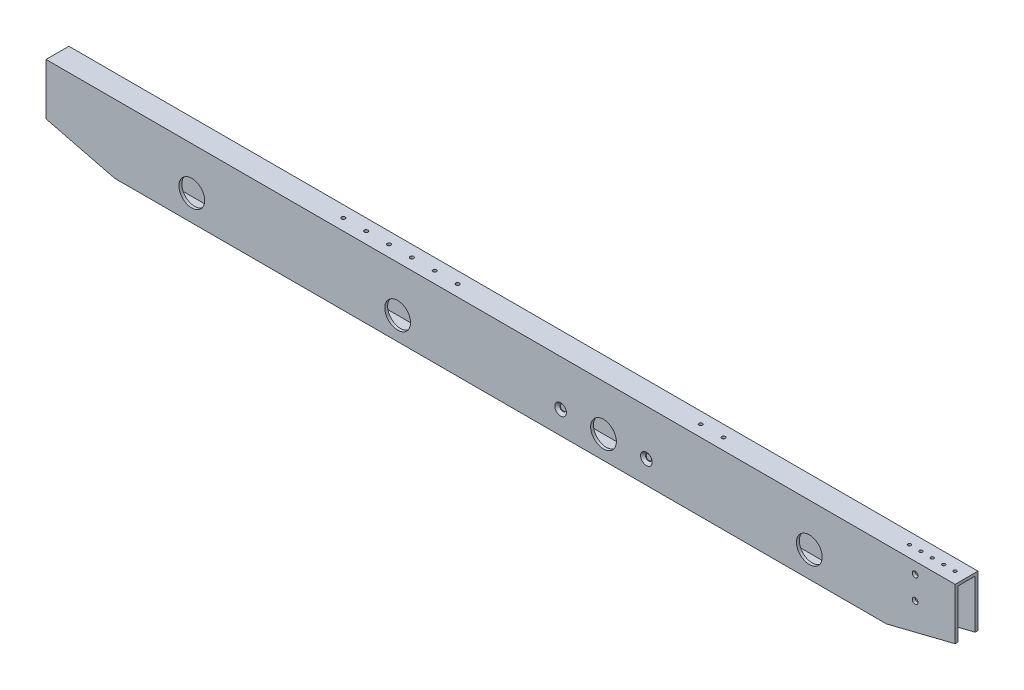
from build123d import *

# Parameters (mm, degrees)
SKETCH1_W                                           = 1009.65
SKETCH1_H                                           = 76.2
SKETCH1_R                                           = 14.2875
BOSS_EXTRUDE2_DEPTH                                 = 12.7
SKETCH3_W                                           = 19.05
SKETCH3_H                                           = 69.85
CUT_EXTRUDE2_DEPTH                                  = 1011.448426442
CUT_EXTRUDE3_DEPTH                                  = 507.897475457
SKETCH9_R                                           = 1.7272
CUT_EXTRUDE4_DEPTH                                  = 2.54
SKETCH12_R                                          = 2.0193
CUT_EXTRUDE7_DEPTH                                  = 5.08
CSK_FOR_1_4_FLAT_HEAD_MACHINE_SCREW_100_D           = 6.7564
CSK_FOR_1_4_FLAT_HEAD_MACHINE_SCREW_100_CSINK_D     = 12.8778
CSK_FOR_1_4_FLAT_HEAD_MACHINE_SCREW_100_CSINK_ANGLE = 100
SKETCH17_R                                          = 1.7272
CUT_EXTRUDE8_DEPTH                                  = 6.35
SKETCH18_R                                          = 17.4625
CUT_EXTRUDE9_DEPTH                                  = 3.81
F_1_4_0_25_DIAMETER_HOLE1_D                         = 6.35
F_10_32_TAPPED_HOLE2_D                              = 4.0386


with BuildPart() as part:
    # Sketch1 → Boss-Extrude2 (new, symmetric)
    with BuildSketch(Plane.XY):
        Rectangle(SKETCH1_W, SKETCH1_H)
        with Locations((-114.3, -12.7)):
            Circle(SKETCH1_R, mode=Mode.SUBTRACT)
        with Locations((114.3, -12.7)):
            Circle(SKETCH1_R, mode=Mode.SUBTRACT)
        with Locations((-342.9, -9.525)):
            Circle(SKETCH1_R, mode=Mode.SUBTRACT)
        with Locations((342.9, -9.525)):
            Circle(SKETCH1_R, mode=Mode.SUBTRACT)
    extrude(amount=BOSS_EXTRUDE2_DEPTH, both=True)

    # Sketch3 → Cut-Extrude2 (cut, through all)
    with BuildSketch(Plane(origin=(504.825, 0, 0), x_dir=(0, 0, -1), z_dir=(1, 0, 0))):
        Rectangle(SKETCH3_W, SKETCH3_H)
    extrude(amount=-CUT_EXTRUDE2_DEPTH, mode=Mode.SUBTRACT)

    # Sketch4 → Cut-Extrude3 (cut, through all)
    with BuildSketch(Plane.XY.offset(12.7)):
        Polygon((-504.825, -38.1), (-504.825, -19.05), (-428.625, -38.1), align=None)
        Polygon((428.625, -38.1), (504.825, -38.1), (504.825, -19.05), align=None)
    extrude(amount=-CUT_EXTRUDE3_DEPTH, mode=Mode.SUBTRACT)

    # Sketch9 → Cut-Extrude4 (cut)
    with BuildSketch(Plane(origin=(0, 38.1, 0), x_dir=(1, 0, 0), z_dir=(0, 1, 0))):
        with Locations((492.125, 0)):
            Circle(SKETCH9_R)
        with Locations((479.425, 0)):
            Circle(SKETCH9_R)
        with Locations((466.725, 0)):
            Circle(SKETCH9_R)
        with Locations((454.025, 0)):
            Circle(SKETCH9_R)
        with Locations((441.325, 0)):
            Circle(SKETCH9_R)
    extrude(amount=-CUT_EXTRUDE4_DEPTH, mode=Mode.SUBTRACT)

    # Sketch12 → Cut-Extrude7 (cut)
    with BuildSketch(Plane(origin=(0, 38.1, 0), x_dir=(1, 0, 0), z_dir=(0, 1, 0))):
        with Locations((-187.325, 0)):
            Circle(SKETCH12_R)
        with Locations((-161.925, 0)):
            Circle(SKETCH12_R)
        with Locations((-136.525, 0)):
            Circle(SKETCH12_R)
        with Locations((-111.125, 0)):
            Circle(SKETCH12_R)
        with Locations((-85.725, 0)):
            Circle(SKETCH12_R)
        with Locations((-60.325, 0)):
            Circle(SKETCH12_R)
    extrude(amount=-CUT_EXTRUDE7_DEPTH, mode=Mode.SUBTRACT)

    # CSK for 1/4 Flat Head Machine Screw (100)2 (through all)
    with Locations(Plane.XY.offset(12.7)):
        with Locations((66.675, -12.7), (161.925, -12.7)):
            CounterSinkHole(CSK_FOR_1_4_FLAT_HEAD_MACHINE_SCREW_100_D / 2, CSK_FOR_1_4_FLAT_HEAD_MACHINE_SCREW_100_CSINK_D / 2, counter_sink_angle=CSK_FOR_1_4_FLAT_HEAD_MACHINE_SCREW_100_CSINK_ANGLE)

    # Sketch17 → Cut-Extrude8 (cut)
    with BuildSketch(Plane(origin=(0, -38.1, 0), x_dir=(-1, 0, 0), z_dir=(0, -1, 0))):
        with Locations((-396.875, 0)):
            Circle(SKETCH17_R)
        with Locations((-320.675, 0)):
            Circle(SKETCH17_R)
        with Locations((-244.475, 0)):
            Circle(SKETCH17_R)
        with Locations((-168.275, 0)):
            Circle(SKETCH17_R)
        with Locations((-92.075, 0)):
            Circle(SKETCH17_R)
        with Locations((-15.875, 0)):
            Circle(SKETCH17_R)
        with Locations((60.325, 0)):
            Circle(SKETCH17_R)
    extrude(amount=-CUT_EXTRUDE8_DEPTH, mode=Mode.SUBTRACT)

    # Sketch18 → Cut-Extrude9 (cut)
    with BuildSketch(Plane(origin=(0, 0, -12.7), x_dir=(-1, 0, 0), z_dir=(0, 0, -1))):
        with Locations((-114.3, -12.7)):
            Circle(SKETCH18_R)
    extrude(amount=-CUT_EXTRUDE9_DEPTH, mode=Mode.SUBTRACT)

    # 1/4 (0.25) Diameter Hole1 (through all)
    with Locations(Plane.XY.offset(12.7)):
        with Locations((460.375, 25.4), (460.375, 0)):
            Hole(F_1_4_0_25_DIAMETER_HOLE1_D / 2)

    # #10-32 Tapped Hole2 (through all)
    with Locations(Plane(origin=(0, 38.1, 0), x_dir=(1, 0, 0), z_dir=(0, 1, 0))):
        with Locations((234.95, 0), (209.55, 0)):
            Hole(F_10_32_TAPPED_HOLE2_D / 2)


solid = part.part
